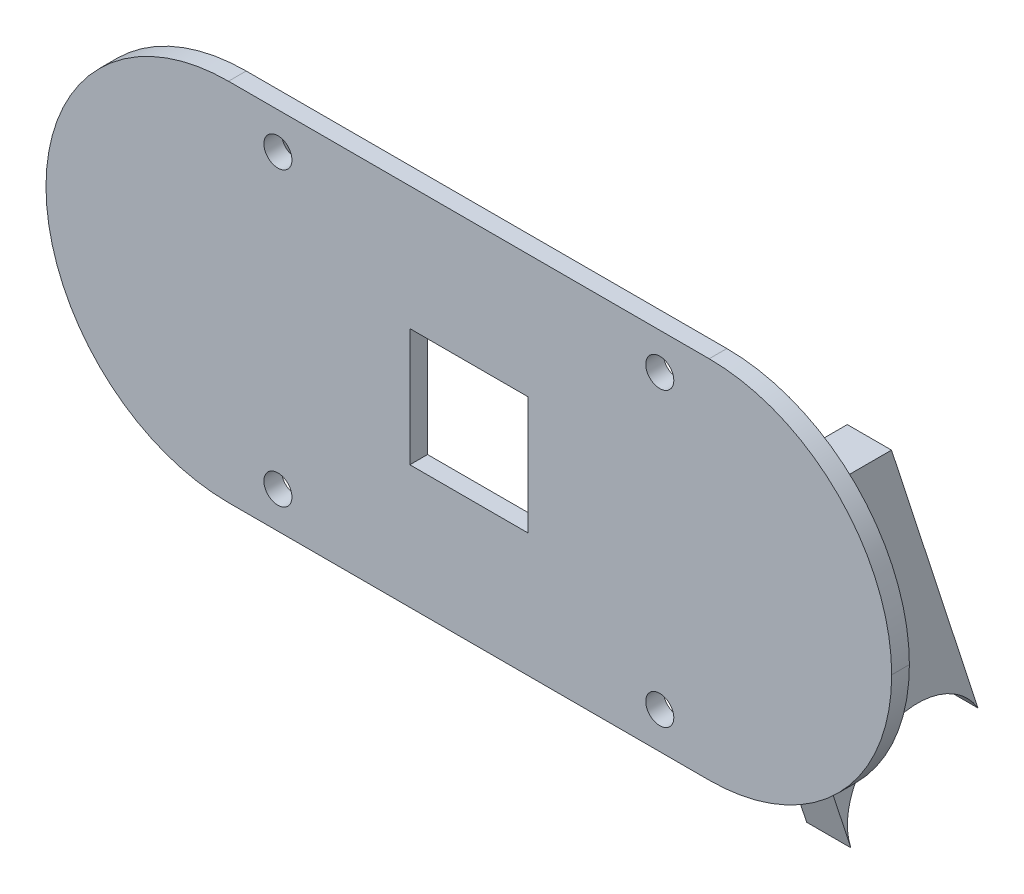
from build123d import *

# Parameters (mm, degrees)
SKETCH1_W           = 191.262
SKETCH1_H           = 82.55
SKETCH1_R           = 3.175
SKETCH1_W_2         = 26.67
SKETCH1_H_2         = 26.67
BOSS_EXTRUDE1_DEPTH = 4
FILLET5_R           = 41.275
BOSS_EXTRUDE2_DEPTH = 10
LPATTERN1_COUNT     = 2
LPATTERN1_PITCH     = 130


with BuildPart() as part:
    # Sketch1 → Boss-Extrude1 (new body)
    with BuildSketch(Plane.XY):
        Rectangle(SKETCH1_W, SKETCH1_H)
        with Locations((-43.18, 33.02)):
            Circle(SKETCH1_R, mode=Mode.SUBTRACT)
        with Locations((43.18, 33.02)):
            Circle(SKETCH1_R, mode=Mode.SUBTRACT)
        with Locations((43.18, -33.02)):
            Circle(SKETCH1_R, mode=Mode.SUBTRACT)
        with Locations((-43.18, -33.02)):
            Circle(SKETCH1_R, mode=Mode.SUBTRACT)
        Rectangle(SKETCH1_W_2, SKETCH1_H_2, mode=Mode.SUBTRACT)
    extrude(amount=BOSS_EXTRUDE1_DEPTH)

    # Fillet5
    fillet5_edges = [part.edges().sort_by_distance(p)[0] for p in [
        (-95.631, -41.275, 2),
        (95.631, -41.275, 2),
        (95.631, 41.275, 2),
        (-95.631, 41.275, 2),
    ]]
    fillet(fillet5_edges, radius=FILLET5_R - 0.0001)  # a hair under: the kernel refuses the full size

    # Sketch2 → Boss-Extrude2 (add)
    with BuildSketch(Plane(origin=(71.59, 0, 0), x_dir=(0, 0, -1), z_dir=(1, 0, 0))):
        with BuildLine():
            Line((0, 20), (20, 20))
            Line((20, 20), (39.561185263, -40.310839577))
            ThreePointArc((39.561185263, -40.310839577), (19.368102567, -33.925421898), (10.798120439, -53.292650765))
            Line((10.798120439, -53.292650765), (0, -20))
            Line((0, -20), (0, 20))
        make_face()
    boss_extrude2 = extrude(amount=-BOSS_EXTRUDE2_DEPTH)

    # LPattern1: Boss-Extrude2 ×2
    with Locations(*[(-i * LPATTERN1_PITCH, 0, 0) for i in range(1, LPATTERN1_COUNT)]):
        add(boss_extrude2)


solid = part.part
